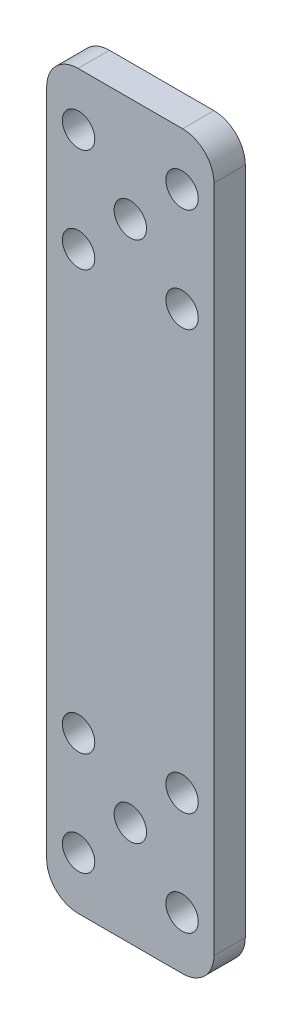
from build123d import *

# Parameters (mm, degrees)
SKETCH_1_R          = 1.55
EXTRUDE_1_DEPTH     = 3
SKETCH_2_W          = 30.67898901
SKETCH_2_H          = 20.291672983
CUT_EXTRUDE_1_DEPTH = 10
SKETCH_3_R          = 1
CUT_EXTRUDE_2_DEPTH = 20
SKETCH_4_W          = 23.960943262
SKETCH_4_H          = 52.328724607
CUT_EXTRUDE_3_DEPTH = 10
FILLET_1_R          = 3


with BuildPart() as part:
    # 草图1 → 凸台-拉伸1 (new body)
    with BuildSketch(Plane.XY):
        with BuildLine():
            Line((5, 16.216737463), (-5, 16.216737463))
            ThreePointArc((-5, 16.216737463), (-7.121320344, 15.338057806), (-8, 13.216737463))
            Line((-8, 13.216737463), (-8, -66.783262537))
            Line((-8, -66.783262537), (-4, -108.783262537))
            Line((-4, -108.783262537), (4, -108.783262537))
            Line((4, -108.783262537), (8, -66.783262537))
            Line((8, -66.783262537), (8, 13.216737463))
            ThreePointArc((8, 13.216737463), (7.121320344, 15.338057806), (5, 16.216737463))
        make_face()
        with Locations((-4.949747468, 11.166484931)):
            Circle(SKETCH_1_R, mode=Mode.SUBTRACT)
        with Locations((4.949747468, 11.166484931)):
            Circle(SKETCH_1_R, mode=Mode.SUBTRACT)
        with Locations((4.949747468, 1.266989995)):
            Circle(SKETCH_1_R, mode=Mode.SUBTRACT)
        with Locations((-4.949747468, 1.266989995)):
            Circle(SKETCH_1_R, mode=Mode.SUBTRACT)
        with Locations((0, -43.783262537)):
            Circle(SKETCH_1_R, mode=Mode.SUBTRACT)
        with Locations((4.949747468, -38.833515069)):
            Circle(SKETCH_1_R, mode=Mode.SUBTRACT)
        with Locations((-4.949747468, -38.833515069)):
            Circle(SKETCH_1_R, mode=Mode.SUBTRACT)
        with Locations((4.949747468, -48.733010005)):
            Circle(SKETCH_1_R, mode=Mode.SUBTRACT)
        with Locations((-4.949747468, -48.733010005)):
            Circle(SKETCH_1_R, mode=Mode.SUBTRACT)
        with Locations((0, 6.216737463)):
            Circle(SKETCH_1_R, mode=Mode.SUBTRACT)
    extrude(amount=EXTRUDE_1_DEPTH)

    # 草图2 → 切除-拉伸1 (cut)
    with BuildSketch(Plane(origin=(0, 0, 0), x_dir=(-1, 0, 0), z_dir=(0, 0, -1))):
        with Locations((1.230440634, -108.929099029)):
            Rectangle(SKETCH_2_W, SKETCH_2_H)
    extrude(amount=-CUT_EXTRUDE_1_DEPTH, mode=Mode.SUBTRACT)

    # 草图3 → 切除-拉伸2 (cut)
    with BuildSketch(Plane(origin=(0, 0, 0), x_dir=(-1, 0, 0), z_dir=(0, 0, -1))):
        with Locations((0, -83.783262537)):
            Circle(SKETCH_3_R)
        with Locations((0, -90.783262537)):
            Circle(SKETCH_3_R)
        with Locations((0, -73.783262537)):
            Circle(SKETCH_3_R)
    extrude(amount=-CUT_EXTRUDE_2_DEPTH, mode=Mode.SUBTRACT)

    # 草图4 → 切除-拉伸3 (cut)
    with BuildSketch(Plane(origin=(0, 0, 0), x_dir=(-1, 0, 0), z_dir=(0, 0, -1))):
        with Locations((3.980471631, -79.947624841)):
            Rectangle(SKETCH_4_W, SKETCH_4_H)
    extrude(amount=-CUT_EXTRUDE_3_DEPTH, mode=Mode.SUBTRACT)

    # 圆角1
    fillet_1_edges = [part.edges().sort_by_distance(p)[0] for p in [
        (-8, -53.783262537, 1.5),
        (8, -53.783262537, 1.5),
    ]]
    fillet(fillet_1_edges, radius=FILLET_1_R)


solid = part.part
